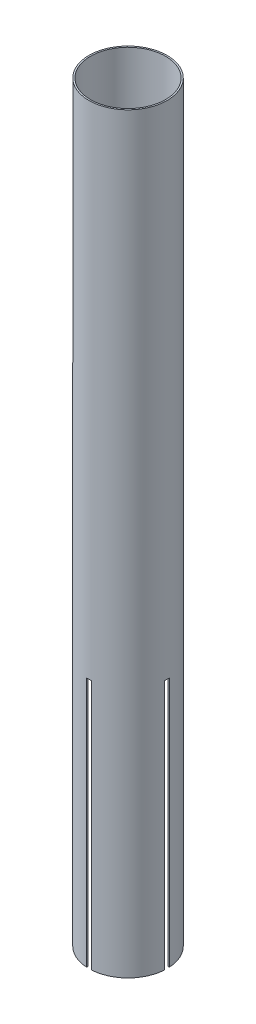
from build123d import *

# Parameters (mm, degrees)
SKETCH1_R           = 39.624
SKETCH1_R_2         = 38.1
BOSS_EXTRUDE1_DEPTH = 762
SKETCH2_W           = 4.7625
SKETCH2_H           = 254
CUT_EXTRUDE1_DEPTH  = 765.057669782
CIRPATTERN1_COUNT   = 2
CIRPATTERN1_ANGLE   = 90


with BuildPart() as part:
    # Sketch1 → Boss-Extrude1 (new body)
    with BuildSketch(Plane(origin=(0, 0, 0), x_dir=(1, 0, 0), z_dir=(0, 1, 0))):
        Circle(SKETCH1_R)
        Circle(SKETCH1_R_2, mode=Mode.SUBTRACT)
    extrude(amount=BOSS_EXTRUDE1_DEPTH)

    # Sketch2 → Cut-Extrude1 (cut, symmetric)
    with BuildSketch(Plane.XY):
        with Locations((0, 127)):
            Rectangle(SKETCH2_W, SKETCH2_H)
    cut_extrude1 = extrude(amount=CUT_EXTRUDE1_DEPTH, both=True, mode=Mode.SUBTRACT)

    # CirPattern1: Cut-Extrude1 ×2 about axis
    cirpattern1_axis = Axis((0, 762, 0), (0, 1, 0))
    for i in range(1, CIRPATTERN1_COUNT):
        add(cut_extrude1.rotate(cirpattern1_axis, i * CIRPATTERN1_ANGLE / (CIRPATTERN1_COUNT - 1)), mode=Mode.SUBTRACT)


solid = part.part
